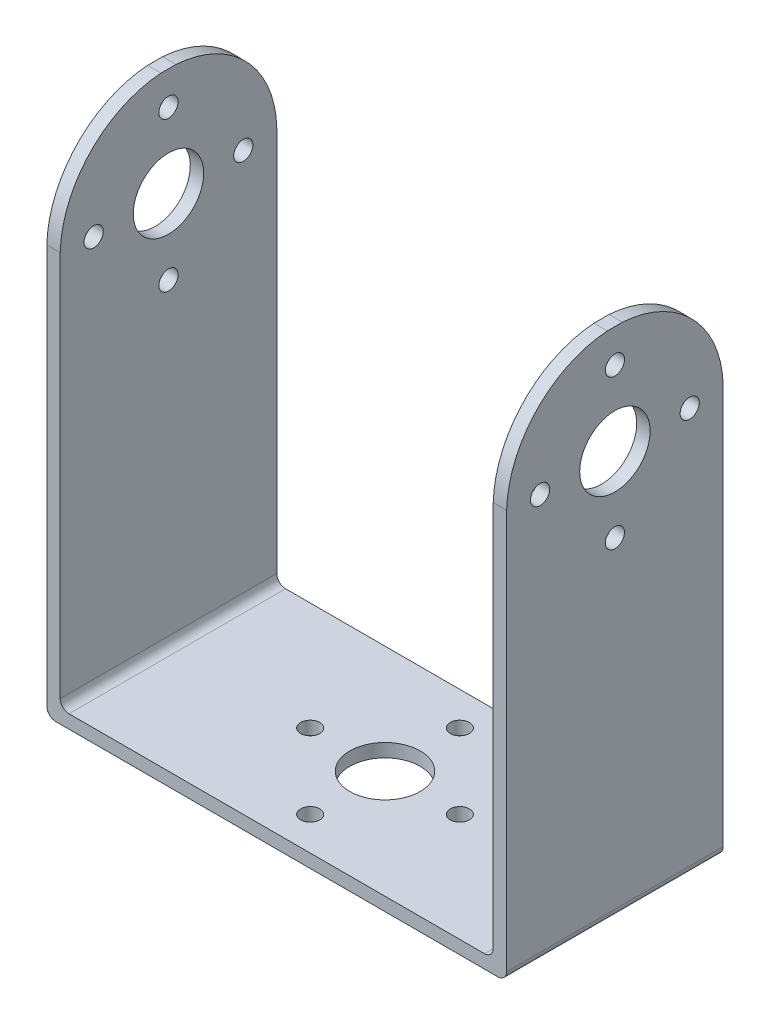
from build123d import *

# Parameters (mm, degrees)
BOSS_EXTRUDE1_DEPTH    = 24.61
CUT_EXTRUDE5_START     = -1.52
CUT_EXTRUDE5_OUTLINE_R = 4
CUT_EXTRUDE5_DEPTH     = 1.52
SKETCH4_R              = 1.09
CUT_EXTRUDE6_DEPTH     = 100
CIRPATTERN1_COUNT      = 4
SKETCH5_R              = 4
CUT_EXTRUDE7_DEPTH     = 50
SKETCH6_R              = 1.09
CUT_EXTRUDE8_DEPTH     = 50
CIRPATTERN2_COUNT      = 4
FILLET1_R              = 1


# Read off the part's stored shape, not the designer's step: Cut-Extrude5
with BuildPart() as part:
    # Sketch1 → Boss-Extrude1 (new body)
    with BuildSketch(Plane.XY):
        Polygon((-26.125, 58.34), (-26.125, 0), (26.125, 0), (26.125, 58.34), (24.605, 58.34), (24.605, 1.52), (-24.605, 1.52), (-24.605, 58.34), align=None)
    extrude(amount=BOSS_EXTRUDE1_DEPTH)

    # Cut-Extrude5 outline → Cut-Extrude5 (cut)
    with BuildSketch(Plane.ZY.offset(26.125).offset(CUT_EXTRUDE5_START)):
        with BuildLine():
            ThreePointArc((0, 46.410820467), (3.42252503, 54.582777623), (11.446105362, 58.34))
            Line((11.446105362, 58.34), (0, 58.34))
            Line((0, 58.34), (0, 46.410820467))
        make_face()
        with BuildLine():
            Line((24.61, 58.34), (13.163894638, 58.34))
            ThreePointArc((13.163894638, 58.34), (21.18747497, 54.582777623), (24.61, 46.410820467))
            Line((24.61, 46.410820467), (24.61, 58.34))
        make_face()
        with Locations((12.305, 46.06)):
            Circle(CUT_EXTRUDE5_OUTLINE_R)
    cut_extrude5 = extrude(amount=CUT_EXTRUDE5_DEPTH, mode=Mode.SUBTRACT)

    # Mirror1: Cut-Extrude5 across plane
    add(cut_extrude5.mirror(Plane(origin=(0, 0, 0), x_dir=(0, 0, 1), z_dir=(1, 0, 0))), mode=Mode.SUBTRACT)

    # Sketch4 → Cut-Extrude6 (cut)
    with BuildSketch(Plane.ZY.offset(26.125)):
        with Locations(Location((12.305, 54.56, 0), (0, 0, 270))):
            Circle(SKETCH4_R)
    cut_extrude6 = extrude(amount=-CUT_EXTRUDE6_DEPTH, mode=Mode.SUBTRACT)

    # CirPattern1: Cut-Extrude6 ×4 about axis
    cirpattern1_axis = Axis((0, 46.06, 12.305), (1, 0, 0))
    for i in range(1, CIRPATTERN1_COUNT):
        add(cut_extrude6.rotate(cirpattern1_axis, i * 360 / CIRPATTERN1_COUNT), mode=Mode.SUBTRACT)

    # Sketch5 → Cut-Extrude7 (cut, symmetric)
    with BuildSketch(Plane(origin=(0, 1.52, 0), x_dir=(1, 0, 0), z_dir=(0, 1, 0))):
        with Locations(Location((0, -12.305, 0), (0, 0, 270))):
            Circle(SKETCH5_R)
    extrude(amount=CUT_EXTRUDE7_DEPTH, both=True, mode=Mode.SUBTRACT)

    # Sketch6 → Cut-Extrude8 (cut, symmetric)
    with BuildSketch(Plane(origin=(0, 1.52, 0), x_dir=(1, 0, 0), z_dir=(0, 1, 0))):
        with Locations(Location((0, -3.805, 0), (0, 0, 270))):
            Circle(SKETCH6_R)
    cut_extrude8 = extrude(amount=CUT_EXTRUDE8_DEPTH, both=True, mode=Mode.SUBTRACT)

    # CirPattern2: Cut-Extrude8 ×4 about axis
    cirpattern2_axis = Axis((0, 0, 12.305), (0, 1, 0))
    for i in range(1, CIRPATTERN2_COUNT):
        add(cut_extrude8.rotate(cirpattern2_axis, i * 360 / CIRPATTERN2_COUNT), mode=Mode.SUBTRACT)

    # Fillet1
    fillet1_edges = [part.edges().sort_by_distance(p)[0] for p in [
        (-24.605, 1.52, 12.305),
        (24.605, 1.52, 12.305),
        (26.125, 0, 12.305),
        (-26.125, 0, 12.305),
    ]]
    fillet(fillet1_edges, radius=FILLET1_R)


solid = part.part
